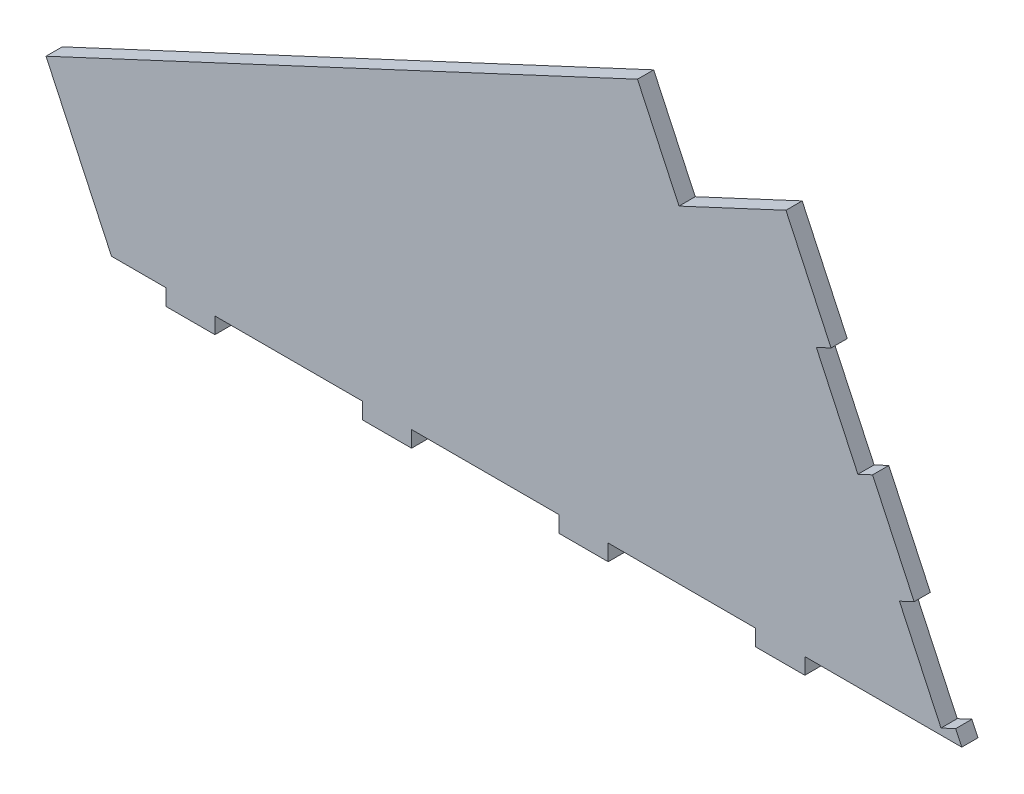
from build123d import *

# Parameters (mm, degrees)
BOSS_EXTRUDE1_DEPTH = 3.3
CUT_EXTRUDE1_DEPTH  = 3.3
SKETCH3_W           = 10
SKETCH3_H           = 3.717341371
SKETCH3_H_2         = 3.573770135
SKETCH3_H_3         = 3.710817969
SKETCH3_H_4         = 3.509523946
BOSS_EXTRUDE2_DEPTH = 3.3


with BuildPart() as part:
    # Sketch1 → Boss-Extrude1 (new body)
    with BuildSketch(Plane.XY):
        Polygon((321.546211238, 12.63462605), (148.585992238, 12.63462605), (135.256612252, 41.219573688), (255.573677729, 97.324342727), (264.026042964, 79.198186987), (285.777429853, 89.341025269), align=None)
    extrude(amount=-BOSS_EXTRUDE1_DEPTH)

    # Sketch2 → Cut-Extrude1 (cut)
    with BuildSketch(Plane.XY):
        Polygon((303.404032301, 51.540654333), (294.951667066, 69.666810074), (291.960851369, 68.27216981), (300.413216604, 50.14601407), align=None)
        Polygon((320.308762771, 15.288342852), (311.856397536, 33.414498593), (308.865581839, 32.019858329), (317.317947074, 13.893702588), align=None)
    extrude(amount=-CUT_EXTRUDE1_DEPTH, mode=Mode.SUBTRACT)

    # Sketch3 → Boss-Extrude2 (add)
    with BuildSketch(Plane.XY):
        with Locations((284.617848709, 11.193296754)):
            Rectangle(SKETCH3_W, SKETCH3_H)
        with Locations((244.617848709, 11.121511136)):
            Rectangle(SKETCH3_W, SKETCH3_H_2)
        with Locations((204.617848709, 11.190035053)):
            Rectangle(SKETCH3_W, SKETCH3_H_3)
        with Locations((164.617848709, 11.089388041)):
            Rectangle(SKETCH3_W, SKETCH3_H_4)
    extrude(amount=-BOSS_EXTRUDE2_DEPTH)


solid = part.part
